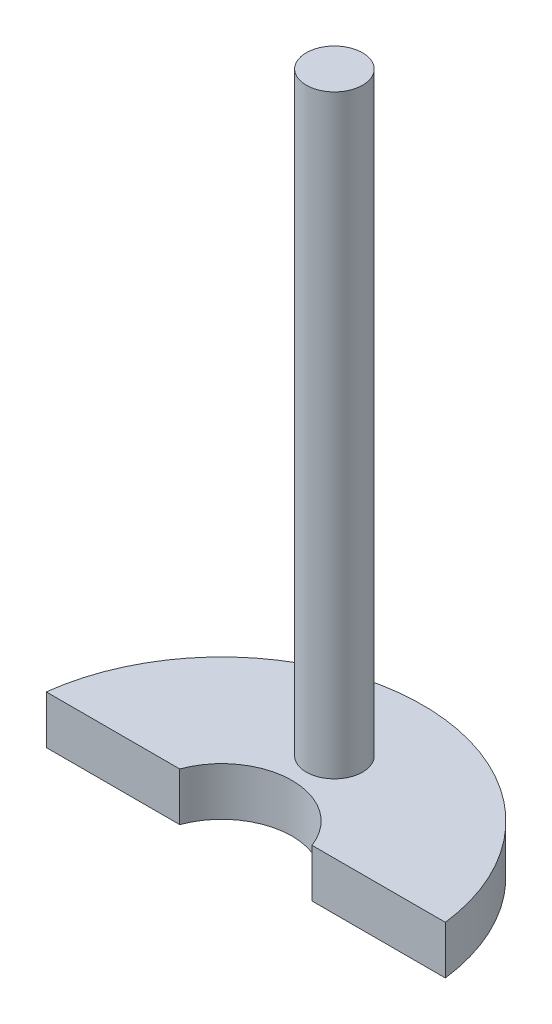
from build123d import *

# Parameters (mm, degrees)
BASEPLATEV2_DEPTH = 3
SKETCH11_14_R     = 1.75
RODV2_DEPTH       = 40


with BuildPart() as part:
    # Sketch11 → BasePlateV2 (new body)
    with BuildSketch(Plane(origin=(0, 0, 0), x_dir=(1, 0, 0), z_dir=(0, 1, 0))):
        with BuildLine():
            ThreePointArc((12.409673646, 1.5), (0, 12.5), (-12.409673646, 1.5))
            Line((-12.409673646, 1.5), (-4.109820556, 1.5))
            ThreePointArc((-4.109820556, 1.5), (0, 4.375), (4.109820556, 1.5))
            Line((4.109820556, 1.5), (12.409673646, 1.5))
        make_face()
    extrude(amount=BASEPLATEV2_DEPTH)

    # Sketch11<14> → RodV2 (add)
    with BuildSketch(Plane(origin=(0, 0, 0), x_dir=(1, 0, 0), z_dir=(0, 1, 0))):
        with Locations((0, 7.011085481)):
            Circle(SKETCH11_14_R)
    extrude(amount=RODV2_DEPTH)


solid = part.part
